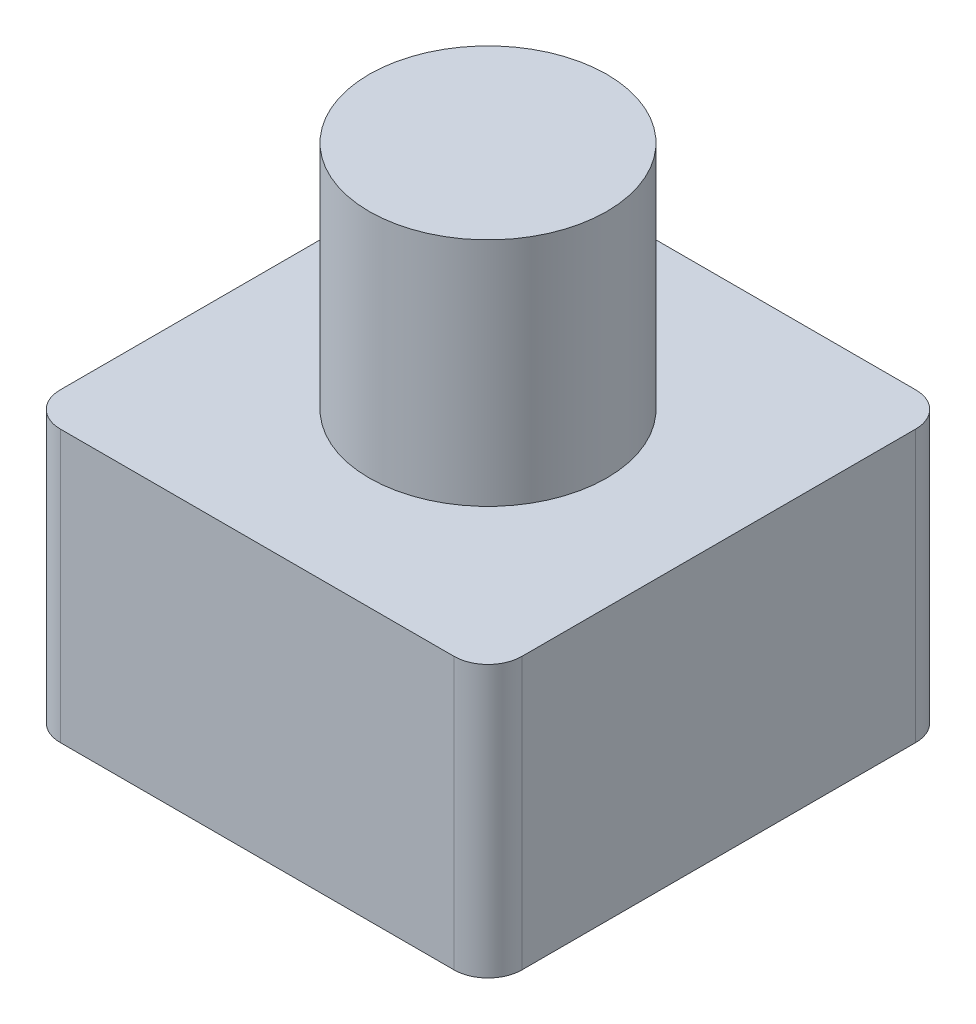
from build123d import *

# Parameters (mm, degrees)
BOSS_EXTRUDE1_DEPTH = 40
SKETCH2_R           = 17.5
BOSS_EXTRUDE2_DEPTH = 34


with BuildPart() as part:
    # Sketch1 → Boss-Extrude1 (new body)
    with BuildSketch(Plane(origin=(0, 0, 0), x_dir=(1, 0, 0), z_dir=(0, 1, 0))):
        with BuildLine():
            Line((-29, 34), (29, 34))
            ThreePointArc((29, 34), (32.535533906, 32.535533906), (34, 29))
            Line((34, 29), (34, -29))
            ThreePointArc((34, -29), (32.535533906, -32.535533906), (29, -34))
            Line((29, -34), (-29, -34))
            ThreePointArc((-29, -34), (-32.535533906, -32.535533906), (-34, -29))
            Line((-34, -29), (-34, 29))
            ThreePointArc((-34, 29), (-32.535533906, 32.535533906), (-29, 34))
        make_face()
    extrude(amount=BOSS_EXTRUDE1_DEPTH)

    # Sketch2 → Boss-Extrude2 (add)
    with BuildSketch(Plane(origin=(0, 40, 0), x_dir=(1, 0, 0), z_dir=(0, 1, 0))):
        Circle(SKETCH2_R)
    extrude(amount=BOSS_EXTRUDE2_DEPTH)


solid = part.part
